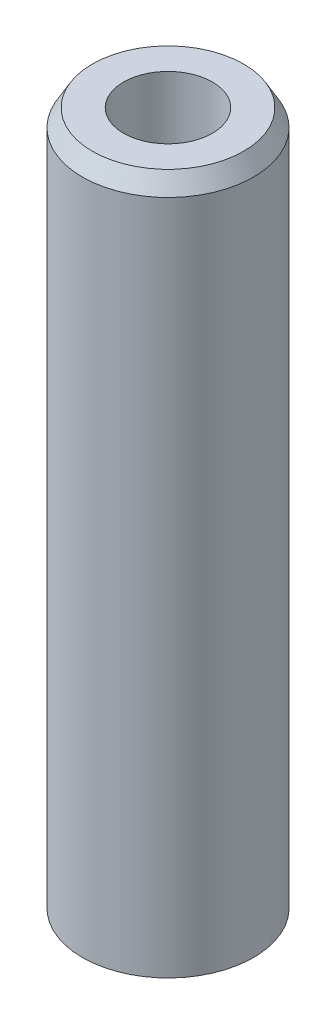
from build123d import *
from OCP.BRepFilletAPI import BRepFilletAPI_MakeChamfer

# Parameters (mm, degrees)
SKETCH1_R           = 25
BOSS_EXTRUDE1_DEPTH = 205.360323865
SKETCH2_R           = 12.968417835
CUT_EXTRUDE1_DEPTH  = 209.381531374
CHAMFER1_SIZE       = 5.055056762
CHAMFER1_SIZE2      = 2.918538383


with BuildPart() as part:
    # Sketch1 → Boss-Extrude1 (new body)
    with BuildSketch(Plane(origin=(0, 0, 0), x_dir=(1, 0, 0), z_dir=(0, 1, 0))):
        Circle(SKETCH1_R)
    extrude(amount=BOSS_EXTRUDE1_DEPTH)

    # Sketch2 → Cut-Extrude1 (cut, through all)
    with BuildSketch(Plane(origin=(0, 0, 0), x_dir=(1, 0, 0), z_dir=(0, 1, 0))):
        Circle(SKETCH2_R)
    extrude(amount=CUT_EXTRUDE1_DEPTH, mode=Mode.SUBTRACT)

    # Chamfer1: one chamfer whose edges measure the first distance from different faces: ONE call of the kernel's chamfer builder (chamfer() names one face for all edges)
    chamfer1_edges_1 = [part.edges().sort_by_distance(p)[0] for p in [
        (-25, 205.360323865, 0),
    ]]
    chamfer1_side_1 = [part.faces().sort_by_distance(p)[0] for p in [
        (-25, 102.680161932, 0),
    ]]
    chamfer1_edges_2 = [part.edges().sort_by_distance(p)[0] for p in [
        (-25, 0, 0),
    ]]
    chamfer1_side_2 = [part.faces().sort_by_distance(p)[0] for p in [
        (-24.292893219, 0, 0),
    ]]
    chamfer1 = BRepFilletAPI_MakeChamfer(part.part.solid().wrapped)
    for e in chamfer1_edges_1:
        chamfer1.Add(CHAMFER1_SIZE, CHAMFER1_SIZE2, e.wrapped, chamfer1_side_1[0].wrapped)  # the first distance lies on this face
    for e in chamfer1_edges_2:
        chamfer1.Add(CHAMFER1_SIZE, CHAMFER1_SIZE2, e.wrapped, chamfer1_side_2[0].wrapped)  # the first distance lies on this face
    add(Compound.cast(chamfer1.Shape()), mode=Mode.REPLACE)


solid = part.part
